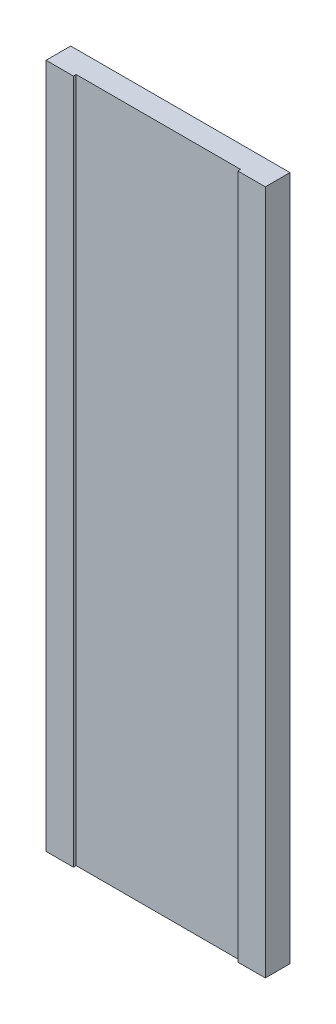
from build123d import *

# Parameters (mm, degrees)
CROQUIS1_W              = 80
CROQUIS1_H              = 250
SALIENTE_EXTRUIR1_DEPTH = 8
CROQUIS2_W              = 10
CROQUIS2_H              = 250
SALIENTE_EXTRUIR2_DEPTH = 1


with BuildPart() as part:
    # Croquis1 → Saliente-Extruir1 (new body)
    with BuildSketch(Plane.XY):
        with Locations((40, 125)):
            Rectangle(CROQUIS1_W, CROQUIS1_H)
    extrude(amount=SALIENTE_EXTRUIR1_DEPTH)

    # Croquis2 → Saliente-Extruir2 (add)
    with BuildSketch(Plane.XY.offset(8)):
        with Locations((5, 125)):
            Rectangle(CROQUIS2_W, CROQUIS2_H)
        with Locations((75, 125)):
            Rectangle(CROQUIS2_W, CROQUIS2_H)
    extrude(amount=SALIENTE_EXTRUIR2_DEPTH)


solid = part.part
